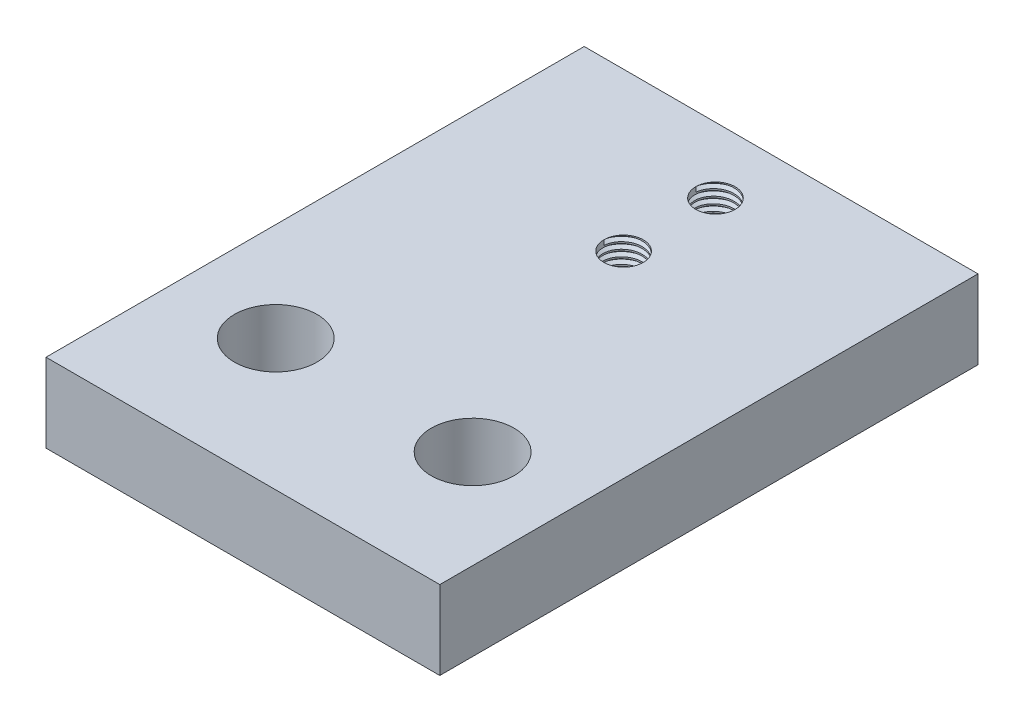
from build123d import *

# Parameters (mm, degrees)
SKETCH1_W           = 30
SKETCH1_H           = 41
SKETCH1_R           = 1.5
SKETCH1_R_2         = 3.15
BOSS_EXTRUDE1_DEPTH = 6
THREAD1_PITCH       = 0.5
THREAD2_PITCH       = 0.5


with BuildPart() as part:
    # Sketch1 → Boss-Extrude1 (new body)
    with BuildSketch(Plane(origin=(0, 0, 0), x_dir=(1, 0, 0), z_dir=(0, 1, 0))):
        Rectangle(SKETCH1_W, SKETCH1_H)
        with Locations(Location((0, 15.5, 0), (0, 0, 270))):
            Circle(SKETCH1_R, mode=Mode.SUBTRACT)
        with Locations(Location((0, 8.5, 0), (0, 0, 270))):
            Circle(SKETCH1_R, mode=Mode.SUBTRACT)
        with Locations(Location((-7.5, -10.5, 0), (0, 0, 270))):
            Circle(SKETCH1_R_2, mode=Mode.SUBTRACT)
        with Locations(Location((7.5, -10.5, 0), (0, 0, 90))):
            Circle(SKETCH1_R_2, mode=Mode.SUBTRACT)
    extrude(amount=BOSS_EXTRUDE1_DEPTH)

    # Thread1: the profile of Thread Profile1 profile screwed along a right-hand helix of 20 turns, 6 arcs to a turn; built about Z, then put on its axis
    thread1_z = Axis((0, 0, 0), (0, 0, 1))
    thread1_corners = [(1.4997, 0, -0.000173205), (1.770632938, 0, 0.156249999), (1.770632938, 0, 0.218749999), (1.4997, 0, 0.375173204)]
    with BuildLine(mode=Mode.PRIVATE) as thread1_profile:
        Line(thread1_corners[0], thread1_corners[1])
        Line(thread1_corners[1], thread1_corners[2])
        Line(thread1_corners[2], thread1_corners[3])
        Line(thread1_corners[3], thread1_corners[0])
    thread1_cap = Face(thread1_profile.wire())
    thread1_turn_angles = [0, 30, 60, 90, 120, 150, 180, 210, 240, 270, 300, 330, 360]
    thread1_turn_weights = [1, 0.8660254037844387, 1, 0.8660254037844387, 1, 0.8660254037844387, 1, 0.8660254037844387, 1, 0.8660254037844387, 1, 0.8660254037844387, 1]
    thread1_turn_rails = [Edge.make_bspline([Vector(p[0], p[1], 0).rotate(thread1_z, thread1_turn_angles[k]) / thread1_turn_weights[k] + Vector(0, 0, p[2] + THREAD1_PITCH * thread1_turn_angles[k] / 360) for k in range(13)], [0, 0, 0, 1, 1, 2, 2, 3, 3, 4, 4, 5, 5, 6, 6, 6], 2, thread1_turn_weights) for p in thread1_corners]
    thread1_turn_sides = [Face.make_surface_from_curves(thread1_turn_rails[p[0]], thread1_turn_rails[p[1]]) for p in [(0, 1), (1, 2), (2, 3), (3, 0)]]
    thread1 = Plane(origin=(0, 6, -15.5), x_dir=(-1, 0, 0), z_dir=(0, -1, 0)) * Solid(Shell([*[p.moved(Location((0, 0, THREAD1_PITCH * i))) for i in range(20) for p in thread1_turn_sides], thread1_cap, thread1_cap.rotate(thread1_z, 7200).moved(Location((0, 0, THREAD1_PITCH * 7200 / 360)))]))
    add(thread1, mode=Mode.SUBTRACT)

    # Thread2: the profile of Thread Profile2 profile screwed along a right-hand helix of 20 turns, 6 arcs to a turn; built about Z, then put on its axis
    thread2_z = Axis((0, 0, 0), (0, 0, 1))
    thread2_corners = [(1.4997, 0, -0.000173205), (1.770632938, 0, 0.156249999), (1.770632938, 0, 0.218749999), (1.4997, 0, 0.375173204)]
    with BuildLine(mode=Mode.PRIVATE) as thread2_profile:
        Line(thread2_corners[0], thread2_corners[1])
        Line(thread2_corners[1], thread2_corners[2])
        Line(thread2_corners[2], thread2_corners[3])
        Line(thread2_corners[3], thread2_corners[0])
    thread2_cap = Face(thread2_profile.wire())
    thread2_turn_angles = [0, 30, 60, 90, 120, 150, 180, 210, 240, 270, 300, 330, 360]
    thread2_turn_weights = [1, 0.8660254037844387, 1, 0.8660254037844387, 1, 0.8660254037844387, 1, 0.8660254037844387, 1, 0.8660254037844387, 1, 0.8660254037844387, 1]
    thread2_turn_rails = [Edge.make_bspline([Vector(p[0], p[1], 0).rotate(thread2_z, thread2_turn_angles[k]) / thread2_turn_weights[k] + Vector(0, 0, p[2] + THREAD2_PITCH * thread2_turn_angles[k] / 360) for k in range(13)], [0, 0, 0, 1, 1, 2, 2, 3, 3, 4, 4, 5, 5, 6, 6, 6], 2, thread2_turn_weights) for p in thread2_corners]
    thread2_turn_sides = [Face.make_surface_from_curves(thread2_turn_rails[p[0]], thread2_turn_rails[p[1]]) for p in [(0, 1), (1, 2), (2, 3), (3, 0)]]
    thread2 = Plane(origin=(0, 6, -8.5), x_dir=(-1, 0, 0), z_dir=(0, -1, 0)) * Solid(Shell([*[p.moved(Location((0, 0, THREAD2_PITCH * i))) for i in range(20) for p in thread2_turn_sides], thread2_cap, thread2_cap.rotate(thread2_z, 7200).moved(Location((0, 0, THREAD2_PITCH * 7200 / 360)))]))
    add(thread2, mode=Mode.SUBTRACT)


solid = part.part
